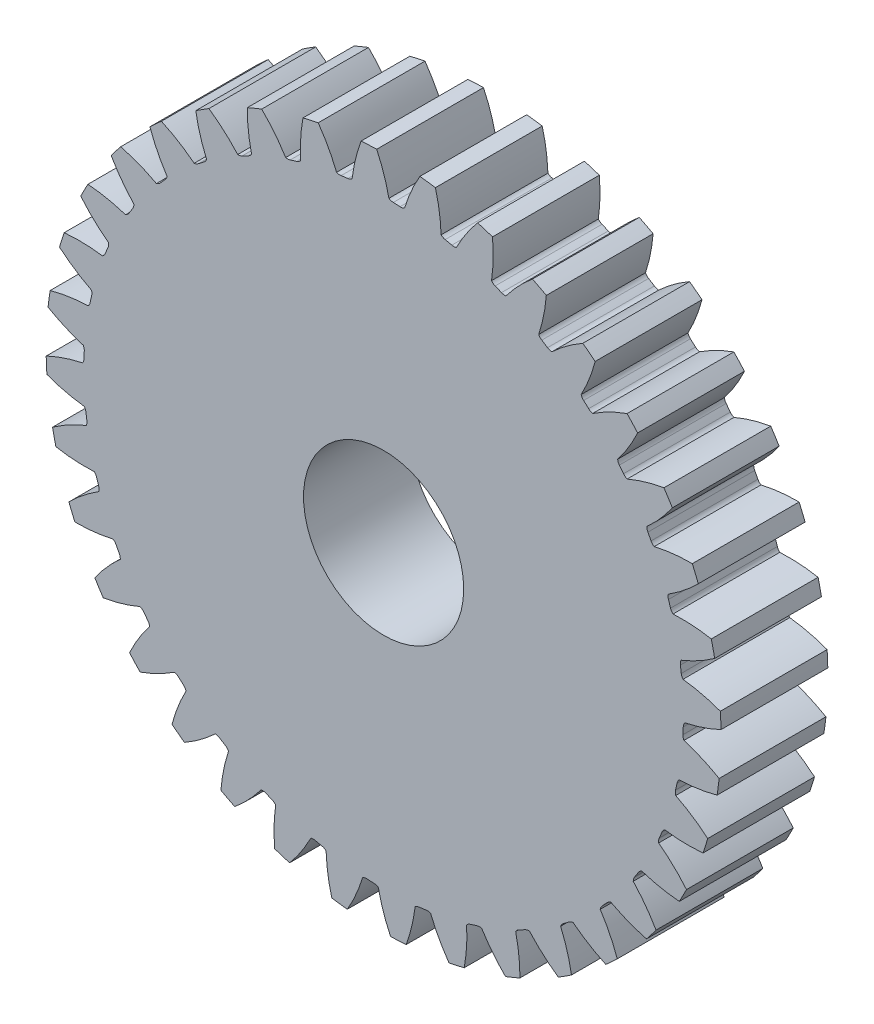
from build123d import *

# Parameters (mm, degrees)
SKETCH1_R                = 10.033
BOSS_EXTRUDE1_DEPTH      = 3.175
CUT_EXTRUDE1_DEPTH       = 15.539697487
FILLET1_R                = 0.2493645
CIRPATTERN1_COUNT        = 36
FILLET1_OF_CIRPATTERN1_R = 0.2493645
SKETCH5_R                = 2.38125
CUT_EXTRUDE2_DEPTH       = 15.536788976


with BuildPart() as part:
    # Sketch1 → Boss-Extrude1 (new body)
    with BuildSketch(Plane.XY):
        Circle(SKETCH1_R)
    extrude(amount=-BOSS_EXTRUDE1_DEPTH)

    # Sketch4 → Cut-Extrude1 (cut, through all)
    with BuildSketch(Plane.XY):
        with BuildLine():
            Line((0.158117624, 8.949175479), (0.158117624, 8.911351505))
            ThreePointArc((0.158117624, 8.911351505), (0.388769785, 8.90427116), (0.619161335, 8.891221855))
            Line((0.619161335, 8.891221855), (0.622457919, 8.928901897))
            add(Edge.make_bspline(
                [(3.58997209, 12.144330526), (1.26898047, 11.049650312), (0.622457919, 8.928901897)],
                knots=[0, 0, 0, 1, 1, 1], degree=2))
            ThreePointArc((3.58997209, 12.144330526), (0.552389923, 12.651779673), (-2.517860482, 12.411004879))
            add(Edge.make_bspline(
                [(-2.517860482, 12.411004879), (-0.301108868, 11.118202053), (0.158117624, 8.949175479)],
                knots=[0, 0, 0, 1, 1, 1], degree=2))
        make_face()
    cut_extrude1 = extrude(amount=-CUT_EXTRUDE1_DEPTH, mode=Mode.SUBTRACT)

    # Fillet1
    # the kernel refuses this fillet: 0.2493645 mm, written as the material it adds along each edge
    with BuildSketch(Plane(origin=(0.619161335, 8.891221855, 0), x_dir=(-0.9980616671564655, 0.0622326968149105, 0), z_dir=(0, 0, -1))) as fillet1_piece_1:
        with BuildLine():
            CenterArc((0.131081385, 0.249357942), FILLET1_R, 238.031532618, 31.552947117)
            Line((-0.000945264, 0.03781216), (-0.003585797, 0.033581245))
            ThreePointArc((-0.003585797, 0.033581245), (-0.005458364, 0.018781442), (-0.004985732, -0.000124638))
            Line((-0.004985732, -0.000124638), (3.6168e-05, -0.004987159))
            ThreePointArc((3.6168e-05, -0.004987159), (0.06463648, -0.004752911), (0.129236792, -0.004987159))
            Line((0.129236792, -0.004987159), (0.12927296, 0))
        make_face()
    extrude(amount=3.175)
    with BuildSketch(Plane(origin=(0.158117624, 8.911351505, 0), x_dir=(9.219577351059759e-12, 1.0, 0), z_dir=(0, 0, -1))) as fillet1_piece_2:
        with BuildLine():
            CenterArc((0.24600419, 0.137272181), FILLET1_R, 181.847555475, 31.552947117)
            Line((-0.003230677, 0.129232585), (-0.008215374, 0.129071793))
            ThreePointArc((-0.008215374, 0.129071793), (-0.006366765, 0.064497512), (-0.004986505, -8.8478e-05))
            Line((-0.004986505, -8.8478e-05), (0, -0.00498729))
            ThreePointArc((0, -0.00498729), (0.018911987, -0.00498729), (0.033660369, -0.002745444))
            Line((0.033660369, -0.002745444), (0.037823974, 0))
        make_face()
    extrude(amount=3.175)

    # CirPattern1: Cut-Extrude1 ×36 about axis
    cirpattern1_axis = Axis((0, 0, -3.175), (0, 0, 1))
    for i in range(1, CIRPATTERN1_COUNT):
        add(cut_extrude1.rotate(cirpattern1_axis, i * 360 / CIRPATTERN1_COUNT), mode=Mode.SUBTRACT)

    # Fillet1 of CirPattern1
    # the kernel refuses this fillet: 0.2493645 mm, written as the material it adds along each edge
    with BuildSketch(Plane(origin=(-0.934189589, 8.863660454, 0), x_dir=(-0.9937054621931857, -0.1120243473867494, 0), z_dir=(0, 0, -1)), Plane(origin=(-2.459155636, 8.566781216, 0), x_dir=(-0.9591560196003878, -0.28287758848014205, 0), z_dir=(0, 0, -1)), Plane(origin=(-3.909401482, 8.009604665, 0), x_dir=(-0.8954631067084013, -0.4451357371905097, 0), z_dir=(0, 0, -1)), Plane(origin=(-5.240862143, 7.209060329, 0), x_dir=(-0.8045620004452726, -0.5938686617759025, 0), z_dir=(0, 0, -1)), Plane(origin=(-6.41308186, 6.189472343, 0), x_dir=(-0.6892146849266395, -0.7245571875852678, 0), z_dir=(0, 0, -1)), Plane(origin=(-7.39044333, 4.981820373, 0), x_dir=(-0.552925929965966, -0.8332304098934891, 0), z_dir=(0, 0, -1)), Plane(origin=(-8.143249919, 3.622798311, 0), x_dir=(-0.39983680041727765, -0.9165863478320383, 0), z_dir=(0, 0, -1)), Plane(origin=(-8.648627979, 2.153699355, 0), x_dir=(-0.23459883201511664, -0.9720922734067703, 0), z_dir=(0, 0, -1)), Plane(origin=(-8.891221855, 0.619161335, 0), x_dir=(-0.062232696814910685, -0.9980616671564655, 0), z_dir=(0, 0, -1)), Plane(origin=(-8.863660454, -0.934189589, 0), x_dir=(0.11202434738675134, -0.9937054621931856, 0), z_dir=(0, 0, -1)), Plane(origin=(-8.566781216, -2.459155636, 0), x_dir=(0.282877588480143, -0.9591560196003874, 0), z_dir=(0, 0, -1)), Plane(origin=(-8.009604665, -3.909401482, 0), x_dir=(0.4451357371905152, -0.8954631067083985, 0), z_dir=(0, 0, -1)), Plane(origin=(-7.209060329, -5.240862143, 0), x_dir=(0.5938686617759025, -0.8045620004452726, 0), z_dir=(0, 0, -1)), Plane(origin=(-6.189472343, -6.41308186, 0), x_dir=(0.7245571875852677, -0.6892146849266397, 0), z_dir=(0, 0, -1)), Plane(origin=(-4.981820373, -7.39044333, 0), x_dir=(0.8332304098935016, -0.552925929965947, 0), z_dir=(0, 0, -1)), Plane(origin=(-3.622798311, -8.143249919, 0), x_dir=(0.9165863478320407, -0.39983680041727176, 0), z_dir=(0, 0, -1)), Plane(origin=(-2.153699355, -8.648627979, 0), x_dir=(0.9720922734067707, -0.23459883201511508, 0), z_dir=(0, 0, -1)), Plane(origin=(-0.619161335, -8.891221855, 0), x_dir=(0.9980616671564657, -0.06223269681490984, 0), z_dir=(0, 0, -1)), Plane(origin=(0.934189589, -8.863660454, 0), x_dir=(0.9937054621931842, 0.11202434738676124, 0), z_dir=(0, 0, -1)), Plane(origin=(2.459155636, -8.566781216, 0), x_dir=(0.9591560196003899, 0.282877588480135, 0), z_dir=(0, 0, -1)), Plane(origin=(3.909401482, -8.009604665, 0), x_dir=(0.8954631067084038, 0.44513573719050414, 0), z_dir=(0, 0, -1)), Plane(origin=(5.240862143, -7.209060329, 0), x_dir=(0.804562000445285, 0.5938686617758856, 0), z_dir=(0, 0, -1)), Plane(origin=(6.41308186, -6.189472343, 0), x_dir=(0.6892146849266397, 0.7245571875852677, 0), z_dir=(0, 0, -1)), Plane(origin=(7.39044333, -4.981820373, 0), x_dir=(0.5529259299659643, 0.8332304098934901, 0), z_dir=(0, 0, -1)), Plane(origin=(8.143249919, -3.622798311, 0), x_dir=(0.3998368004172842, 0.9165863478320355, 0), z_dir=(0, 0, -1)), Plane(origin=(8.648627979, -2.153699355, 0), x_dir=(0.23459883201511822, 0.9720922734067698, 0), z_dir=(0, 0, -1)), Plane(origin=(8.891221855, -0.619161335, 0), x_dir=(0.06223269681490979, 0.9980616671564657, 0), z_dir=(0, 0, -1)), Plane(origin=(8.863660454, 0.934189589, 0), x_dir=(-0.11202434738674999, 0.9937054621931857, 0), z_dir=(0, 0, -1)), Plane(origin=(8.566781216, 2.459155636, 0), x_dir=(-0.2828775884801322, 0.9591560196003907, 0), z_dir=(0, 0, -1)), Plane(origin=(8.009604665, 3.909401482, 0), x_dir=(-0.4451357371905069, 0.8954631067084025, 0), z_dir=(0, 0, -1)), Plane(origin=(7.209060329, 5.240862143, 0), x_dir=(-0.5938686617758969, 0.8045620004452768, 0), z_dir=(0, 0, -1)), Plane(origin=(6.189472343, 6.41308186, 0), x_dir=(-0.7245571875852712, 0.6892146849266358, 0), z_dir=(0, 0, -1)), Plane(origin=(4.981820373, 7.39044333, 0), x_dir=(-0.8332304098934901, 0.5529259299659643, 0), z_dir=(0, 0, -1)), Plane(origin=(3.622798311, 8.143249919, 0), x_dir=(-0.916586347832036, 0.3998368004172829, 0), z_dir=(0, 0, -1)), Plane(origin=(2.153699355, 8.648627979, 0), x_dir=(-0.9720922734067696, 0.23459883201511897, 0), z_dir=(0, 0, -1))) as fillet1_of_cirpattern1_piece_1:
        with BuildLine():
            CenterArc((0.131081385, 0.249357942), FILLET1_OF_CIRPATTERN1_R, 238.031532618, 31.552947117)
            Line((-0.000945264, 0.03781216), (-0.003585797, 0.033581245))
            ThreePointArc((-0.003585797, 0.033581245), (-0.005458364, 0.018781442), (-0.004985732, -0.000124638))
            Line((-0.004985732, -0.000124638), (3.6168e-05, -0.004987159))
            ThreePointArc((3.6168e-05, -0.004987159), (0.06463648, -0.004752911), (0.129236792, -0.004987159))
            Line((0.129236792, -0.004987159), (0.12927296, 0))
        make_face()
    extrude(amount=3.175)
    with BuildSketch(Plane(origin=(-1.391724487, 8.80342489, 0), x_dir=(-0.17364817765783325, 0.9848077530138121, 0), z_dir=(0, 0, -1)), Plane(origin=(-2.899279754, 8.428010663, 0), x_dir=(-0.3420201433169791, 0.9396926207890711, 0), z_dir=(0, 0, -1)), Plane(origin=(-4.318741873, 7.796515598, 0), x_dir=(-0.4999999999919771, 0.8660254037890707, 0), z_dir=(0, 0, -1)), Plane(origin=(-5.606981206, 6.928127351, 0), x_dir=(-0.6427876096794275, 0.7660444431249456, 0), z_dir=(0, 0, -1)), Plane(origin=(-6.724855252, 5.849231461, 0), x_dir=(-0.7660444431130428, 0.6427876096936127, 0), z_dir=(0, 0, -1)), Plane(origin=(-7.638397974, 4.592609632, 0), x_dir=(-0.8660254037798071, 0.500000000008022, 0), z_dir=(0, 0, -1)), Plane(origin=(-8.319851838, 3.196443684, 0), x_dir=(-0.9396926207827389, 0.3420201433343767, 0), z_dir=(0, 0, -1)), Plane(origin=(-8.748511215, 1.703155412, 0), x_dir=(-0.9848077530106006, 0.17364817767604618, 0), z_dir=(0, 0, -1)), Plane(origin=(-8.911351505, 0.158117624, 0), x_dir=(-1.0, 9.232785914599958e-12, 0), z_dir=(0, 0, -1)), Plane(origin=(-8.80342489, -1.391724487, 0), x_dir=(-0.9848077530138186, -0.17364817765779678, 0), z_dir=(0, 0, -1)), Plane(origin=(-8.428010663, -2.899279754, 0), x_dir=(-0.9396926207890749, -0.3420201433169688, 0), z_dir=(0, 0, -1)), Plane(origin=(-7.796515598, -4.318741873, 0), x_dir=(-0.8660254037890767, -0.499999999991967, 0), z_dir=(0, 0, -1)), Plane(origin=(-6.928127351, -5.606981206, 0), x_dir=(-0.7660444431249358, -0.642787609679439, 0), z_dir=(0, 0, -1)), Plane(origin=(-5.849231461, -6.724855252, 0), x_dir=(-0.6427876096936105, -0.7660444431130445, 0), z_dir=(0, 0, -1)), Plane(origin=(-4.592609632, -7.638397974, 0), x_dir=(-0.5000000000080295, -0.8660254037798027, 0), z_dir=(0, 0, -1)), Plane(origin=(-3.196443684, -8.319851838, 0), x_dir=(-0.34202014333436076, -0.9396926207827448, 0), z_dir=(0, 0, -1)), Plane(origin=(-1.703155412, -8.748511215, 0), x_dir=(-0.1736481776760291, -0.9848077530106037, 0), z_dir=(0, 0, -1)), Plane(origin=(-0.158117624, -8.911351505, 0), x_dir=(-9.22618163282986e-12, -1.0, 0), z_dir=(0, 0, -1)), Plane(origin=(1.391724487, -8.80342489, 0), x_dir=(0.17364817765780816, -0.9848077530138166, 0), z_dir=(0, 0, -1)), Plane(origin=(2.899279754, -8.428010663, 0), x_dir=(0.3420201433169791, -0.9396926207890711, 0), z_dir=(0, 0, -1)), Plane(origin=(4.318741873, -7.796515598, 0), x_dir=(0.4999999999920049, -0.8660254037890547, 0), z_dir=(0, 0, -1)), Plane(origin=(5.606981206, -6.928127351, 0), x_dir=(0.6427876096794506, -0.7660444431249261, 0), z_dir=(0, 0, -1)), Plane(origin=(6.724855252, -5.849231461, 0), x_dir=(0.766044443113033, -0.6427876096936243, 0), z_dir=(0, 0, -1)), Plane(origin=(7.638397974, -4.592609632, 0), x_dir=(0.8660254037798233, -0.5000000000079943, 0), z_dir=(0, 0, -1)), Plane(origin=(8.319851838, -3.196443684, 0), x_dir=(0.9396926207827448, -0.34202014333436076, 0), z_dir=(0, 0, -1)), Plane(origin=(8.748511215, -1.703155412, 0), x_dir=(0.9848077530106017, -0.1736481776760405, 0), z_dir=(0, 0, -1)), Plane(origin=(8.911351505, -0.158117624, 0), x_dir=(1.0, -9.220311160145325e-12, 0), z_dir=(0, 0, -1)), Plane(origin=(8.80342489, 1.391724487, 0), x_dir=(0.9848077530138186, 0.17364817765779678, 0), z_dir=(0, 0, -1)), Plane(origin=(8.428010663, 2.899279754, 0), x_dir=(0.9396926207890673, 0.3420201433169895, 0), z_dir=(0, 0, -1)), Plane(origin=(7.796515598, 4.318741873, 0), x_dir=(0.8660254037890547, 0.4999999999920049, 0), z_dir=(0, 0, -1)), Plane(origin=(6.928127351, 5.606981206, 0), x_dir=(0.7660444431249358, 0.642787609679439, 0), z_dir=(0, 0, -1)), Plane(origin=(5.849231461, 6.724855252, 0), x_dir=(0.6427876096936402, 0.7660444431130196, 0), z_dir=(0, 0, -1)), Plane(origin=(4.592609632, 7.638397974, 0), x_dir=(0.5000000000079943, 0.8660254037798233, 0), z_dir=(0, 0, -1)), Plane(origin=(3.196443684, 8.319851838, 0), x_dir=(0.34202014333436076, 0.9396926207827448, 0), z_dir=(0, 0, -1)), Plane(origin=(1.703155412, 8.748511215, 0), x_dir=(0.1736481776760519, 0.9848077530105998, 0), z_dir=(0, 0, -1))) as fillet1_of_cirpattern1_piece_2:
        with BuildLine():
            CenterArc((0.24600419, 0.137272181), FILLET1_OF_CIRPATTERN1_R, 181.847555475, 31.552947117)
            Line((-0.003230677, 0.129232585), (-0.008215374, 0.129071793))
            ThreePointArc((-0.008215374, 0.129071793), (-0.006366765, 0.064497512), (-0.004986505, -8.8478e-05))
            Line((-0.004986505, -8.8478e-05), (0, -0.00498729))
            ThreePointArc((0, -0.00498729), (0.018911987, -0.00498729), (0.033660369, -0.002745444))
            Line((0.033660369, -0.002745444), (0.037823974, 0))
        make_face()
    extrude(amount=3.175)

    # Sketch5 → Cut-Extrude2 (cut, through all)
    with BuildSketch(Plane.XY):
        Circle(SKETCH5_R)
    extrude(amount=-CUT_EXTRUDE2_DEPTH, mode=Mode.SUBTRACT)


solid = part.part
